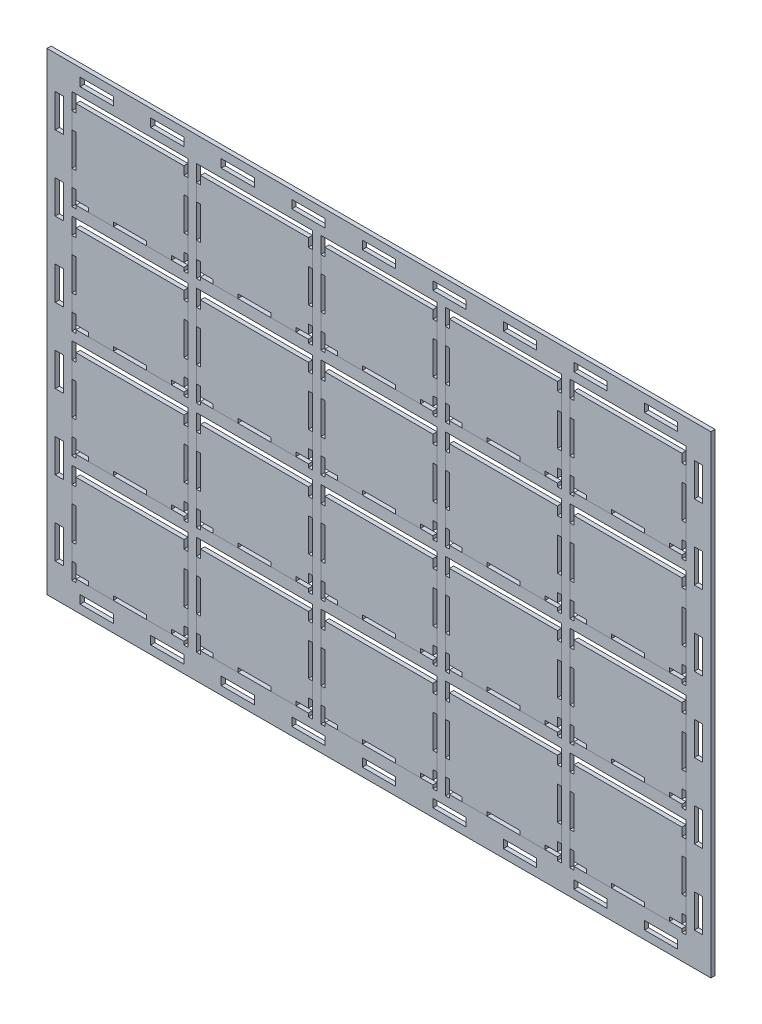
from build123d import *

# Parameters (mm, degrees)
SKETCH1_W              = 400
SKETCH1_H              = 285
SKETCH1_W_2            = 20
SKETCH1_H_2            = 5
SKETCH1_W_3            = 5
SKETCH1_H_3            = 20
BOSS_EXTRUDE1_DEPTH    = 2.5
BOSS_EXTRUDE2_DEPTH    = 2.5
BOSS_EXTRUDE2_2_DEPTH  = 2.5
BOSS_EXTRUDE2_3_DEPTH  = 2.5
BOSS_EXTRUDE2_4_DEPTH  = 2.5
BOSS_EXTRUDE2_5_DEPTH  = 2.5
BOSS_EXTRUDE2_6_DEPTH  = 2.5
BOSS_EXTRUDE2_7_DEPTH  = 2.5
BOSS_EXTRUDE2_8_DEPTH  = 2.5
BOSS_EXTRUDE2_9_DEPTH  = 2.5
BOSS_EXTRUDE2_10_DEPTH = 2.5
BOSS_EXTRUDE2_11_DEPTH = 2.5
BOSS_EXTRUDE2_12_DEPTH = 2.5
BOSS_EXTRUDE2_13_DEPTH = 2.5
BOSS_EXTRUDE2_14_DEPTH = 2.5
BOSS_EXTRUDE2_15_DEPTH = 2.5
BOSS_EXTRUDE2_16_DEPTH = 2.5
BOSS_EXTRUDE2_17_DEPTH = 2.5
BOSS_EXTRUDE2_18_DEPTH = 2.5
BOSS_EXTRUDE2_19_DEPTH = 2.5
BOSS_EXTRUDE2_20_DEPTH = 2.5


with BuildPart() as part:
    # Sketch1 → Boss-Extrude1 (new body)
    with BuildSketch(Plane.XY):
        with Locations((-141.295954422, 26.855853659)):
            Rectangle(SKETCH1_W, SKETCH1_H)
        with Locations((-311.295954422, -108.144146341)):
            Rectangle(SKETCH1_W_2, SKETCH1_H_2, mode=Mode.SUBTRACT)
        with Locations((-333.795954422, -85.644146341)):
            Rectangle(SKETCH1_W_3, SKETCH1_H_3, mode=Mode.SUBTRACT)
        with Locations((-268.795954422, -108.144146341)):
            Rectangle(SKETCH1_W_2, SKETCH1_H_2, mode=Mode.SUBTRACT)
        Polygon((-323.795954422, -98.644146341), (-323.795954422, -100.644146341), (-326.295954422, -100.644146341), (-326.295954422, -90.644146341), (-326.295954422, -80.644146341), (-326.295954422, -60.644146341), (-326.295954422, -50.644146341), (-326.295954422, -40.644146341), (-256.295954422, -40.644146341), (-256.295954422, -50.644146341), (-256.295954422, -60.644146341), (-256.295954422, -80.644146341), (-256.295954422, -90.644146341), (-256.295954422, -100.644146341), (-258.795954422, -100.644146341), (-258.795954422, -98.644146341), (-266.295954422, -98.644146341), (-281.295954422, -98.644146341), (-301.295954422, -98.644146341), (-316.295954422, -98.644146341), align=None, mode=Mode.SUBTRACT)
        with Locations((-226.295954422, -108.144146341)):
            Rectangle(SKETCH1_W_2, SKETCH1_H_2, mode=Mode.SUBTRACT)
        with Locations((-183.795954422, -108.144146341)):
            Rectangle(SKETCH1_W_2, SKETCH1_H_2, mode=Mode.SUBTRACT)
        Polygon((-248.795954422, -98.644146341), (-248.795954422, -100.644146341), (-251.295954422, -100.644146341), (-251.295954422, -90.644146341), (-251.295954422, -80.644146341), (-251.295954422, -60.644146341), (-251.295954422, -50.644146341), (-251.295954422, -40.644146341), (-181.295954422, -40.644146341), (-181.295954422, -50.644146341), (-181.295954422, -60.644146341), (-181.295954422, -80.644146341), (-181.295954422, -90.644146341), (-181.295954422, -100.644146341), (-183.795954422, -100.644146341), (-183.795954422, -98.644146341), (-191.295954422, -98.644146341), (-206.295954422, -98.644146341), (-226.295954422, -98.644146341), (-241.295954422, -98.644146341), align=None, mode=Mode.SUBTRACT)
        with Locations((-333.795954422, -40.644146341)):
            Rectangle(SKETCH1_W_3, SKETCH1_H_3, mode=Mode.SUBTRACT)
        with Locations((-333.795954422, 4.355853659)):
            Rectangle(SKETCH1_W_3, SKETCH1_H_3, mode=Mode.SUBTRACT)
        Polygon((-323.795954422, -33.644146341), (-323.795954422, -35.644146341), (-326.295954422, -35.644146341), (-326.295954422, -25.644146341), (-326.295954422, -15.644146341), (-326.295954422, 4.355853659), (-326.295954422, 14.355853659), (-326.295954422, 24.355853659), (-256.295954422, 24.355853659), (-256.295954422, 14.355853659), (-256.295954422, 4.355853659), (-256.295954422, -15.644146341), (-256.295954422, -25.644146341), (-256.295954422, -35.644146341), (-258.795954422, -35.644146341), (-258.795954422, -33.644146341), (-266.295954422, -33.644146341), (-281.295954422, -33.644146341), (-301.295954422, -33.644146341), (-316.295954422, -33.644146341), align=None, mode=Mode.SUBTRACT)
        Polygon((-248.795954422, -33.644146341), (-248.795954422, -35.644146341), (-251.295954422, -35.644146341), (-251.295954422, -25.644146341), (-251.295954422, -15.644146341), (-251.295954422, 4.355853659), (-251.295954422, 14.355853659), (-251.295954422, 24.355853659), (-181.295954422, 24.355853659), (-181.295954422, 14.355853659), (-181.295954422, 4.355853659), (-181.295954422, -15.644146341), (-181.295954422, -25.644146341), (-181.295954422, -35.644146341), (-183.795954422, -35.644146341), (-183.795954422, -33.644146341), (-191.295954422, -33.644146341), (-206.295954422, -33.644146341), (-226.295954422, -33.644146341), (-241.295954422, -33.644146341), align=None, mode=Mode.SUBTRACT)
        with Locations((-141.295954422, -108.144146341)):
            Rectangle(SKETCH1_W_2, SKETCH1_H_2, mode=Mode.SUBTRACT)
        with Locations((-98.795954422, -108.144146341)):
            Rectangle(SKETCH1_W_2, SKETCH1_H_2, mode=Mode.SUBTRACT)
        with Locations((-56.295954422, -108.144146341)):
            Rectangle(SKETCH1_W_2, SKETCH1_H_2, mode=Mode.SUBTRACT)
        Polygon((-173.795954422, -98.644146341), (-173.795954422, -100.644146341), (-176.295954422, -100.644146341), (-176.295954422, -90.644146341), (-176.295954422, -80.644146341), (-176.295954422, -60.644146341), (-176.295954422, -50.644146341), (-176.295954422, -40.644146341), (-106.295954422, -40.644146341), (-106.295954422, -50.644146341), (-106.295954422, -60.644146341), (-106.295954422, -80.644146341), (-106.295954422, -90.644146341), (-106.295954422, -100.644146341), (-108.795954422, -100.644146341), (-108.795954422, -98.644146341), (-116.295954422, -98.644146341), (-131.295954422, -98.644146341), (-151.295954422, -98.644146341), (-166.295954422, -98.644146341), align=None, mode=Mode.SUBTRACT)
        Polygon((-98.795954422, -98.644146341), (-98.795954422, -100.644146341), (-101.295954422, -100.644146341), (-101.295954422, -90.644146341), (-101.295954422, -80.644146341), (-101.295954422, -60.644146341), (-101.295954422, -50.644146341), (-101.295954422, -40.644146341), (-31.295954422, -40.644146341), (-31.295954422, -50.644146341), (-31.295954422, -60.644146341), (-31.295954422, -80.644146341), (-31.295954422, -90.644146341), (-31.295954422, -100.644146341), (-33.795954422, -100.644146341), (-33.795954422, -98.644146341), (-41.295954422, -98.644146341), (-56.295954422, -98.644146341), (-76.295954422, -98.644146341), (-91.295954422, -98.644146341), align=None, mode=Mode.SUBTRACT)
        with Locations((-13.795954422, -108.144146341)):
            Rectangle(SKETCH1_W_2, SKETCH1_H_2, mode=Mode.SUBTRACT)
        with Locations((28.704045578, -108.144146341)):
            Rectangle(SKETCH1_W_2, SKETCH1_H_2, mode=Mode.SUBTRACT)
        with Locations((51.204045578, -85.644146341)):
            Rectangle(SKETCH1_W_3, SKETCH1_H_3, mode=Mode.SUBTRACT)
        Polygon((-23.795954422, -98.644146341), (-23.795954422, -100.644146341), (-26.295954422, -100.644146341), (-26.295954422, -90.644146341), (-26.295954422, -80.644146341), (-26.295954422, -60.644146341), (-26.295954422, -50.644146341), (-26.295954422, -40.644146341), (43.704045578, -40.644146341), (43.704045578, -50.644146341), (43.704045578, -60.644146341), (43.704045578, -80.644146341), (43.704045578, -90.644146341), (43.704045578, -100.644146341), (41.204045578, -100.644146341), (41.204045578, -98.644146341), (33.704045578, -98.644146341), (18.704045578, -98.644146341), (-1.295954422, -98.644146341), (-16.295954422, -98.644146341), align=None, mode=Mode.SUBTRACT)
        Polygon((-173.795954422, -33.644146341), (-173.795954422, -35.644146341), (-176.295954422, -35.644146341), (-176.295954422, -25.644146341), (-176.295954422, -15.644146341), (-176.295954422, 4.355853659), (-176.295954422, 14.355853659), (-176.295954422, 24.355853659), (-106.295954422, 24.355853659), (-106.295954422, 14.355853659), (-106.295954422, 4.355853659), (-106.295954422, -15.644146341), (-106.295954422, -25.644146341), (-106.295954422, -35.644146341), (-108.795954422, -35.644146341), (-108.795954422, -33.644146341), (-116.295954422, -33.644146341), (-131.295954422, -33.644146341), (-151.295954422, -33.644146341), (-166.295954422, -33.644146341), align=None, mode=Mode.SUBTRACT)
        Polygon((-98.795954422, -33.644146341), (-98.795954422, -35.644146341), (-101.295954422, -35.644146341), (-101.295954422, -25.644146341), (-101.295954422, -15.644146341), (-101.295954422, 4.355853659), (-101.295954422, 14.355853659), (-101.295954422, 24.355853659), (-31.295954422, 24.355853659), (-31.295954422, 14.355853659), (-31.295954422, 4.355853659), (-31.295954422, -15.644146341), (-31.295954422, -25.644146341), (-31.295954422, -35.644146341), (-33.795954422, -35.644146341), (-33.795954422, -33.644146341), (-41.295954422, -33.644146341), (-56.295954422, -33.644146341), (-76.295954422, -33.644146341), (-91.295954422, -33.644146341), align=None, mode=Mode.SUBTRACT)
        with Locations((51.204045578, -40.644146341)):
            Rectangle(SKETCH1_W_3, SKETCH1_H_3, mode=Mode.SUBTRACT)
        Polygon((-23.795954422, -33.644146341), (-23.795954422, -35.644146341), (-26.295954422, -35.644146341), (-26.295954422, -25.644146341), (-26.295954422, -15.644146341), (-26.295954422, 4.355853659), (-26.295954422, 14.355853659), (-26.295954422, 24.355853659), (43.704045578, 24.355853659), (43.704045578, 14.355853659), (43.704045578, 4.355853659), (43.704045578, -15.644146341), (43.704045578, -25.644146341), (43.704045578, -35.644146341), (41.204045578, -35.644146341), (41.204045578, -33.644146341), (33.704045578, -33.644146341), (18.704045578, -33.644146341), (-1.295954422, -33.644146341), (-16.295954422, -33.644146341), align=None, mode=Mode.SUBTRACT)
        with Locations((51.204045578, 4.355853659)):
            Rectangle(SKETCH1_W_3, SKETCH1_H_3, mode=Mode.SUBTRACT)
        with Locations((-333.795954422, 49.355853659)):
            Rectangle(SKETCH1_W_3, SKETCH1_H_3, mode=Mode.SUBTRACT)
        Polygon((-323.795954422, 31.355853659), (-323.795954422, 29.355853659), (-326.295954422, 29.355853659), (-326.295954422, 39.355853659), (-326.295954422, 49.355853659), (-326.295954422, 69.355853659), (-326.295954422, 79.355853659), (-326.295954422, 89.355853659), (-256.295954422, 89.355853659), (-256.295954422, 79.355853659), (-256.295954422, 69.355853659), (-256.295954422, 49.355853659), (-256.295954422, 39.355853659), (-256.295954422, 29.355853659), (-258.795954422, 29.355853659), (-258.795954422, 31.355853659), (-266.295954422, 31.355853659), (-281.295954422, 31.355853659), (-301.295954422, 31.355853659), (-316.295954422, 31.355853659), align=None, mode=Mode.SUBTRACT)
        with Locations((-333.795954422, 94.355853659)):
            Rectangle(SKETCH1_W_3, SKETCH1_H_3, mode=Mode.SUBTRACT)
        Polygon((-248.795954422, 31.355853659), (-248.795954422, 29.355853659), (-251.295954422, 29.355853659), (-251.295954422, 39.355853659), (-251.295954422, 49.355853659), (-251.295954422, 69.355853659), (-251.295954422, 79.355853659), (-251.295954422, 89.355853659), (-181.295954422, 89.355853659), (-181.295954422, 79.355853659), (-181.295954422, 69.355853659), (-181.295954422, 49.355853659), (-181.295954422, 39.355853659), (-181.295954422, 29.355853659), (-183.795954422, 29.355853659), (-183.795954422, 31.355853659), (-191.295954422, 31.355853659), (-206.295954422, 31.355853659), (-226.295954422, 31.355853659), (-241.295954422, 31.355853659), align=None, mode=Mode.SUBTRACT)
        Polygon((-323.795954422, 96.355853659), (-323.795954422, 94.355853659), (-326.295954422, 94.355853659), (-326.295954422, 104.355853659), (-326.295954422, 114.355853659), (-326.295954422, 134.355853659), (-326.295954422, 144.355853659), (-326.295954422, 154.355853659), (-256.295954422, 154.355853659), (-256.295954422, 144.355853659), (-256.295954422, 134.355853659), (-256.295954422, 114.355853659), (-256.295954422, 104.355853659), (-256.295954422, 94.355853659), (-258.795954422, 94.355853659), (-258.795954422, 96.355853659), (-266.295954422, 96.355853659), (-281.295954422, 96.355853659), (-301.295954422, 96.355853659), (-316.295954422, 96.355853659), align=None, mode=Mode.SUBTRACT)
        with Locations((-333.795954422, 139.355853659)):
            Rectangle(SKETCH1_W_3, SKETCH1_H_3, mode=Mode.SUBTRACT)
        with Locations((-311.295954422, 161.855853659)):
            Rectangle(SKETCH1_W_2, SKETCH1_H_2, mode=Mode.SUBTRACT)
        with Locations((-268.795954422, 161.855853659)):
            Rectangle(SKETCH1_W_2, SKETCH1_H_2, mode=Mode.SUBTRACT)
        Polygon((-248.795954422, 96.355853659), (-248.795954422, 94.355853659), (-251.295954422, 94.355853659), (-251.295954422, 104.355853659), (-251.295954422, 114.355853659), (-251.295954422, 134.355853659), (-251.295954422, 144.355853659), (-251.295954422, 154.355853659), (-181.295954422, 154.355853659), (-181.295954422, 144.355853659), (-181.295954422, 134.355853659), (-181.295954422, 114.355853659), (-181.295954422, 104.355853659), (-181.295954422, 94.355853659), (-183.795954422, 94.355853659), (-183.795954422, 96.355853659), (-191.295954422, 96.355853659), (-206.295954422, 96.355853659), (-226.295954422, 96.355853659), (-241.295954422, 96.355853659), align=None, mode=Mode.SUBTRACT)
        with Locations((-226.295954422, 161.855853659)):
            Rectangle(SKETCH1_W_2, SKETCH1_H_2, mode=Mode.SUBTRACT)
        with Locations((-183.795954422, 161.855853659)):
            Rectangle(SKETCH1_W_2, SKETCH1_H_2, mode=Mode.SUBTRACT)
        Polygon((-173.795954422, 31.355853659), (-173.795954422, 29.355853659), (-176.295954422, 29.355853659), (-176.295954422, 39.355853659), (-176.295954422, 49.355853659), (-176.295954422, 69.355853659), (-176.295954422, 79.355853659), (-176.295954422, 89.355853659), (-106.295954422, 89.355853659), (-106.295954422, 79.355853659), (-106.295954422, 69.355853659), (-106.295954422, 49.355853659), (-106.295954422, 39.355853659), (-106.295954422, 29.355853659), (-108.795954422, 29.355853659), (-108.795954422, 31.355853659), (-116.295954422, 31.355853659), (-131.295954422, 31.355853659), (-151.295954422, 31.355853659), (-166.295954422, 31.355853659), align=None, mode=Mode.SUBTRACT)
        Polygon((-98.795954422, 31.355853659), (-98.795954422, 29.355853659), (-101.295954422, 29.355853659), (-101.295954422, 39.355853659), (-101.295954422, 49.355853659), (-101.295954422, 69.355853659), (-101.295954422, 79.355853659), (-101.295954422, 89.355853659), (-31.295954422, 89.355853659), (-31.295954422, 79.355853659), (-31.295954422, 69.355853659), (-31.295954422, 49.355853659), (-31.295954422, 39.355853659), (-31.295954422, 29.355853659), (-33.795954422, 29.355853659), (-33.795954422, 31.355853659), (-41.295954422, 31.355853659), (-56.295954422, 31.355853659), (-76.295954422, 31.355853659), (-91.295954422, 31.355853659), align=None, mode=Mode.SUBTRACT)
        Polygon((-23.795954422, 31.355853659), (-23.795954422, 29.355853659), (-26.295954422, 29.355853659), (-26.295954422, 39.355853659), (-26.295954422, 49.355853659), (-26.295954422, 69.355853659), (-26.295954422, 79.355853659), (-26.295954422, 89.355853659), (43.704045578, 89.355853659), (43.704045578, 79.355853659), (43.704045578, 69.355853659), (43.704045578, 49.355853659), (43.704045578, 39.355853659), (43.704045578, 29.355853659), (41.204045578, 29.355853659), (41.204045578, 31.355853659), (33.704045578, 31.355853659), (18.704045578, 31.355853659), (-1.295954422, 31.355853659), (-16.295954422, 31.355853659), align=None, mode=Mode.SUBTRACT)
        with Locations((51.204045578, 49.355853659)):
            Rectangle(SKETCH1_W_3, SKETCH1_H_3, mode=Mode.SUBTRACT)
        with Locations((51.204045578, 94.355853659)):
            Rectangle(SKETCH1_W_3, SKETCH1_H_3, mode=Mode.SUBTRACT)
        Polygon((-173.795954422, 96.355853659), (-173.795954422, 94.355853659), (-176.295954422, 94.355853659), (-176.295954422, 104.355853659), (-176.295954422, 114.355853659), (-176.295954422, 134.355853659), (-176.295954422, 144.355853659), (-176.295954422, 154.355853659), (-106.295954422, 154.355853659), (-106.295954422, 144.355853659), (-106.295954422, 134.355853659), (-106.295954422, 114.355853659), (-106.295954422, 104.355853659), (-106.295954422, 94.355853659), (-108.795954422, 94.355853659), (-108.795954422, 96.355853659), (-116.295954422, 96.355853659), (-131.295954422, 96.355853659), (-151.295954422, 96.355853659), (-166.295954422, 96.355853659), align=None, mode=Mode.SUBTRACT)
        Polygon((-98.795954422, 96.355853659), (-98.795954422, 94.355853659), (-101.295954422, 94.355853659), (-101.295954422, 104.355853659), (-101.295954422, 114.355853659), (-101.295954422, 134.355853659), (-101.295954422, 144.355853659), (-101.295954422, 154.355853659), (-31.295954422, 154.355853659), (-31.295954422, 144.355853659), (-31.295954422, 134.355853659), (-31.295954422, 114.355853659), (-31.295954422, 104.355853659), (-31.295954422, 94.355853659), (-33.795954422, 94.355853659), (-33.795954422, 96.355853659), (-41.295954422, 96.355853659), (-56.295954422, 96.355853659), (-76.295954422, 96.355853659), (-91.295954422, 96.355853659), align=None, mode=Mode.SUBTRACT)
        with Locations((-141.295954422, 161.855853659)):
            Rectangle(SKETCH1_W_2, SKETCH1_H_2, mode=Mode.SUBTRACT)
        with Locations((-98.795954422, 161.855853659)):
            Rectangle(SKETCH1_W_2, SKETCH1_H_2, mode=Mode.SUBTRACT)
        with Locations((-56.295954422, 161.855853659)):
            Rectangle(SKETCH1_W_2, SKETCH1_H_2, mode=Mode.SUBTRACT)
        Polygon((-23.795954422, 94.355853659), (-26.295954422, 94.355853659), (-26.295954422, 104.355853659), (-26.295954422, 114.355853659), (-26.295954422, 134.355853659), (-26.295954422, 144.355853659), (-26.295954422, 154.355853659), (43.704045578, 154.355853659), (43.704045578, 144.355853659), (43.704045578, 134.355853659), (43.704045578, 114.355853659), (43.704045578, 104.355853659), (43.704045578, 94.355853659), (41.204045578, 94.355853659), (41.204045578, 96.355853659), (33.704045578, 96.355853659), (18.704045578, 96.355853659), (-1.295954422, 96.355853659), (-16.295954422, 96.355853659), (-23.795954422, 96.355853659), align=None, mode=Mode.SUBTRACT)
        with Locations((-13.795954422, 161.855853659)):
            Rectangle(SKETCH1_W_2, SKETCH1_H_2, mode=Mode.SUBTRACT)
        with Locations((51.204045578, 139.355853659)):
            Rectangle(SKETCH1_W_3, SKETCH1_H_3, mode=Mode.SUBTRACT)
        with Locations((28.704045578, 161.855853659)):
            Rectangle(SKETCH1_W_2, SKETCH1_H_2, mode=Mode.SUBTRACT)
    extrude(amount=BOSS_EXTRUDE1_DEPTH)


with BuildPart() as body_2:
    # Sketch1<3> → Boss-Extrude2 (new body)
    with BuildSketch(Plane.XY):
        Polygon((-26.295954422, 114.355853659), (-26.295954422, 104.355853659), (-23.795954422, 104.355853659), (-23.795954422, 98.855853659), (-16.295954422, 98.855853659), (-16.295954422, 96.355853659), (-1.295954422, 96.355853659), (-1.295954422, 98.855853659), (18.704045578, 98.855853659), (18.704045578, 96.355853659), (33.704045578, 96.355853659), (33.704045578, 98.855853659), (41.204045578, 98.855853659), (41.204045578, 104.355853659), (43.704045578, 104.355853659), (43.704045578, 114.355853659), (41.204045578, 114.355853659), (41.204045578, 134.355853659), (43.704045578, 134.355853659), (43.704045578, 144.355853659), (41.204045578, 144.355853659), (41.204045578, 149.355853659), (-23.795954422, 149.355853659), (-23.795954422, 144.355853659), (-26.295954422, 144.355853659), (-26.295954422, 134.355853659), (-23.795954422, 134.355853659), (-23.795954422, 114.355853659), align=None)
    extrude(amount=BOSS_EXTRUDE2_DEPTH)


with BuildPart() as body_3:
    # Sketch1<3> → Boss-Extrude2 2 (new body)
    with BuildSketch(Plane.XY):
        Polygon((-26.295954422, 49.355853659), (-26.295954422, 39.355853659), (-23.795954422, 39.355853659), (-23.795954422, 33.855853659), (-16.295954422, 33.855853659), (-16.295954422, 31.355853659), (-1.295954422, 31.355853659), (-1.295954422, 33.855853659), (18.704045578, 33.855853659), (18.704045578, 31.355853659), (33.704045578, 31.355853659), (33.704045578, 33.855853659), (41.204045578, 33.855853659), (41.204045578, 39.355853659), (43.704045578, 39.355853659), (43.704045578, 49.355853659), (41.204045578, 49.355853659), (41.204045578, 69.355853659), (43.704045578, 69.355853659), (43.704045578, 79.355853659), (41.204045578, 79.355853659), (41.204045578, 84.355853659), (-23.795954422, 84.355853659), (-23.795954422, 79.355853659), (-26.295954422, 79.355853659), (-26.295954422, 69.355853659), (-23.795954422, 69.355853659), (-23.795954422, 49.355853659), align=None)
    extrude(amount=BOSS_EXTRUDE2_2_DEPTH)


with BuildPart() as body_4:
    # Sketch1<3> → Boss-Extrude2 3 (new body)
    with BuildSketch(Plane.XY):
        Polygon((-26.295954422, -15.644146341), (-26.295954422, -25.644146341), (-23.795954422, -25.644146341), (-23.795954422, -31.144146341), (-16.295954422, -31.144146341), (-16.295954422, -33.644146341), (-1.295954422, -33.644146341), (-1.295954422, -31.144146341), (18.704045578, -31.144146341), (18.704045578, -33.644146341), (33.704045578, -33.644146341), (33.704045578, -31.144146341), (41.204045578, -31.144146341), (41.204045578, -25.644146341), (43.704045578, -25.644146341), (43.704045578, -15.644146341), (41.204045578, -15.644146341), (41.204045578, 4.355853659), (43.704045578, 4.355853659), (43.704045578, 14.355853659), (41.204045578, 14.355853659), (41.204045578, 19.355853659), (-23.795954422, 19.355853659), (-23.795954422, 14.355853659), (-26.295954422, 14.355853659), (-26.295954422, 4.355853659), (-23.795954422, 4.355853659), (-23.795954422, -15.644146341), align=None)
    extrude(amount=BOSS_EXTRUDE2_3_DEPTH)


with BuildPart() as body_5:
    # Sketch1<3> → Boss-Extrude2 4 (new body)
    with BuildSketch(Plane.XY):
        Polygon((-26.295954422, -80.644146341), (-26.295954422, -90.644146341), (-23.795954422, -90.644146341), (-23.795954422, -96.144146341), (-16.295954422, -96.144146341), (-16.295954422, -98.644146341), (-1.295954422, -98.644146341), (-1.295954422, -96.144146341), (18.704045578, -96.144146341), (18.704045578, -98.644146341), (33.704045578, -98.644146341), (33.704045578, -96.144146341), (41.204045578, -96.144146341), (41.204045578, -90.644146341), (43.704045578, -90.644146341), (43.704045578, -80.644146341), (41.204045578, -80.644146341), (41.204045578, -60.644146341), (43.704045578, -60.644146341), (43.704045578, -50.644146341), (41.204045578, -50.644146341), (41.204045578, -45.644146341), (-23.795954422, -45.644146341), (-23.795954422, -50.644146341), (-26.295954422, -50.644146341), (-26.295954422, -60.644146341), (-23.795954422, -60.644146341), (-23.795954422, -80.644146341), align=None)
    extrude(amount=BOSS_EXTRUDE2_4_DEPTH)


with BuildPart() as body_6:
    # Sketch1<3> → Boss-Extrude2 5 (new body)
    with BuildSketch(Plane.XY):
        Polygon((-101.295954422, 114.355853659), (-101.295954422, 104.355853659), (-98.795954422, 104.355853659), (-98.795954422, 98.855853659), (-91.295954422, 98.855853659), (-91.295954422, 96.355853659), (-76.295954422, 96.355853659), (-76.295954422, 98.855853659), (-56.295954422, 98.855853659), (-56.295954422, 96.355853659), (-41.295954422, 96.355853659), (-41.295954422, 98.855853659), (-33.795954422, 98.855853659), (-33.795954422, 104.355853659), (-31.295954422, 104.355853659), (-31.295954422, 114.355853659), (-33.795954422, 114.355853659), (-33.795954422, 134.355853659), (-31.295954422, 134.355853659), (-31.295954422, 144.355853659), (-33.795954422, 144.355853659), (-33.795954422, 149.355853659), (-98.795954422, 149.355853659), (-98.795954422, 144.355853659), (-101.295954422, 144.355853659), (-101.295954422, 134.355853659), (-98.795954422, 134.355853659), (-98.795954422, 114.355853659), align=None)
    extrude(amount=BOSS_EXTRUDE2_5_DEPTH)


with BuildPart() as body_7:
    # Sketch1<3> → Boss-Extrude2 6 (new body)
    with BuildSketch(Plane.XY):
        Polygon((-101.295954422, 49.355853659), (-101.295954422, 39.355853659), (-98.795954422, 39.355853659), (-98.795954422, 33.855853659), (-91.295954422, 33.855853659), (-91.295954422, 31.355853659), (-76.295954422, 31.355853659), (-76.295954422, 33.855853659), (-56.295954422, 33.855853659), (-56.295954422, 31.355853659), (-41.295954422, 31.355853659), (-41.295954422, 33.855853659), (-33.795954422, 33.855853659), (-33.795954422, 39.355853659), (-31.295954422, 39.355853659), (-31.295954422, 49.355853659), (-33.795954422, 49.355853659), (-33.795954422, 69.355853659), (-31.295954422, 69.355853659), (-31.295954422, 79.355853659), (-33.795954422, 79.355853659), (-33.795954422, 84.355853659), (-98.795954422, 84.355853659), (-98.795954422, 79.355853659), (-101.295954422, 79.355853659), (-101.295954422, 69.355853659), (-98.795954422, 69.355853659), (-98.795954422, 49.355853659), align=None)
    extrude(amount=BOSS_EXTRUDE2_6_DEPTH)


with BuildPart() as body_8:
    # Sketch1<3> → Boss-Extrude2 7 (new body)
    with BuildSketch(Plane.XY):
        Polygon((-101.295954422, -15.644146341), (-101.295954422, -25.644146341), (-98.795954422, -25.644146341), (-98.795954422, -31.144146341), (-91.295954422, -31.144146341), (-91.295954422, -33.644146341), (-76.295954422, -33.644146341), (-76.295954422, -31.144146341), (-56.295954422, -31.144146341), (-56.295954422, -33.644146341), (-41.295954422, -33.644146341), (-41.295954422, -31.144146341), (-33.795954422, -31.144146341), (-33.795954422, -25.644146341), (-31.295954422, -25.644146341), (-31.295954422, -15.644146341), (-33.795954422, -15.644146341), (-33.795954422, 4.355853659), (-31.295954422, 4.355853659), (-31.295954422, 14.355853659), (-33.795954422, 14.355853659), (-33.795954422, 19.355853659), (-98.795954422, 19.355853659), (-98.795954422, 14.355853659), (-101.295954422, 14.355853659), (-101.295954422, 4.355853659), (-98.795954422, 4.355853659), (-98.795954422, -15.644146341), align=None)
    extrude(amount=BOSS_EXTRUDE2_7_DEPTH)


with BuildPart() as body_9:
    # Sketch1<3> → Boss-Extrude2 8 (new body)
    with BuildSketch(Plane.XY):
        Polygon((-101.295954422, -80.644146341), (-101.295954422, -90.644146341), (-98.795954422, -90.644146341), (-98.795954422, -96.144146341), (-91.295954422, -96.144146341), (-91.295954422, -98.644146341), (-76.295954422, -98.644146341), (-76.295954422, -96.144146341), (-56.295954422, -96.144146341), (-56.295954422, -98.644146341), (-41.295954422, -98.644146341), (-41.295954422, -96.144146341), (-33.795954422, -96.144146341), (-33.795954422, -90.644146341), (-31.295954422, -90.644146341), (-31.295954422, -80.644146341), (-33.795954422, -80.644146341), (-33.795954422, -60.644146341), (-31.295954422, -60.644146341), (-31.295954422, -50.644146341), (-33.795954422, -50.644146341), (-33.795954422, -45.644146341), (-98.795954422, -45.644146341), (-98.795954422, -50.644146341), (-101.295954422, -50.644146341), (-101.295954422, -60.644146341), (-98.795954422, -60.644146341), (-98.795954422, -80.644146341), align=None)
    extrude(amount=BOSS_EXTRUDE2_8_DEPTH)


with BuildPart() as body_10:
    # Sketch1<3> → Boss-Extrude2 9 (new body)
    with BuildSketch(Plane.XY):
        Polygon((-176.295954422, 114.355853659), (-176.295954422, 104.355853659), (-173.795954422, 104.355853659), (-173.795954422, 98.855853659), (-166.295954422, 98.855853659), (-166.295954422, 96.355853659), (-151.295954422, 96.355853659), (-151.295954422, 98.855853659), (-131.295954422, 98.855853659), (-131.295954422, 96.355853659), (-116.295954422, 96.355853659), (-116.295954422, 98.855853659), (-108.795954422, 98.855853659), (-108.795954422, 104.355853659), (-106.295954422, 104.355853659), (-106.295954422, 114.355853659), (-108.795954422, 114.355853659), (-108.795954422, 134.355853659), (-106.295954422, 134.355853659), (-106.295954422, 144.355853659), (-108.795954422, 144.355853659), (-108.795954422, 149.355853659), (-173.795954422, 149.355853659), (-173.795954422, 144.355853659), (-176.295954422, 144.355853659), (-176.295954422, 134.355853659), (-173.795954422, 134.355853659), (-173.795954422, 114.355853659), align=None)
    extrude(amount=BOSS_EXTRUDE2_9_DEPTH)


with BuildPart() as body_11:
    # Sketch1<3> → Boss-Extrude2 10 (new body)
    with BuildSketch(Plane.XY):
        Polygon((-176.295954422, 49.355853659), (-176.295954422, 39.355853659), (-173.795954422, 39.355853659), (-173.795954422, 33.855853659), (-166.295954422, 33.855853659), (-166.295954422, 31.355853659), (-151.295954422, 31.355853659), (-151.295954422, 33.855853659), (-131.295954422, 33.855853659), (-131.295954422, 31.355853659), (-116.295954422, 31.355853659), (-116.295954422, 33.855853659), (-108.795954422, 33.855853659), (-108.795954422, 39.355853659), (-106.295954422, 39.355853659), (-106.295954422, 49.355853659), (-108.795954422, 49.355853659), (-108.795954422, 69.355853659), (-106.295954422, 69.355853659), (-106.295954422, 79.355853659), (-108.795954422, 79.355853659), (-108.795954422, 84.355853659), (-173.795954422, 84.355853659), (-173.795954422, 79.355853659), (-176.295954422, 79.355853659), (-176.295954422, 69.355853659), (-173.795954422, 69.355853659), (-173.795954422, 49.355853659), align=None)
    extrude(amount=BOSS_EXTRUDE2_10_DEPTH)


with BuildPart() as body_12:
    # Sketch1<3> → Boss-Extrude2 11 (new body)
    with BuildSketch(Plane.XY):
        Polygon((-176.295954422, -15.644146341), (-176.295954422, -25.644146341), (-173.795954422, -25.644146341), (-173.795954422, -31.144146341), (-166.295954422, -31.144146341), (-166.295954422, -33.644146341), (-151.295954422, -33.644146341), (-151.295954422, -31.144146341), (-131.295954422, -31.144146341), (-131.295954422, -33.644146341), (-116.295954422, -33.644146341), (-116.295954422, -31.144146341), (-108.795954422, -31.144146341), (-108.795954422, -25.644146341), (-106.295954422, -25.644146341), (-106.295954422, -15.644146341), (-108.795954422, -15.644146341), (-108.795954422, 4.355853659), (-106.295954422, 4.355853659), (-106.295954422, 14.355853659), (-108.795954422, 14.355853659), (-108.795954422, 19.355853659), (-173.795954422, 19.355853659), (-173.795954422, 14.355853659), (-176.295954422, 14.355853659), (-176.295954422, 4.355853659), (-173.795954422, 4.355853659), (-173.795954422, -15.644146341), align=None)
    extrude(amount=BOSS_EXTRUDE2_11_DEPTH)


with BuildPart() as body_13:
    # Sketch1<3> → Boss-Extrude2 12 (new body)
    with BuildSketch(Plane.XY):
        Polygon((-176.295954422, -80.644146341), (-176.295954422, -90.644146341), (-173.795954422, -90.644146341), (-173.795954422, -96.144146341), (-166.295954422, -96.144146341), (-166.295954422, -98.644146341), (-151.295954422, -98.644146341), (-151.295954422, -96.144146341), (-131.295954422, -96.144146341), (-131.295954422, -98.644146341), (-116.295954422, -98.644146341), (-116.295954422, -96.144146341), (-108.795954422, -96.144146341), (-108.795954422, -90.644146341), (-106.295954422, -90.644146341), (-106.295954422, -80.644146341), (-108.795954422, -80.644146341), (-108.795954422, -60.644146341), (-106.295954422, -60.644146341), (-106.295954422, -50.644146341), (-108.795954422, -50.644146341), (-108.795954422, -45.644146341), (-173.795954422, -45.644146341), (-173.795954422, -50.644146341), (-176.295954422, -50.644146341), (-176.295954422, -60.644146341), (-173.795954422, -60.644146341), (-173.795954422, -80.644146341), align=None)
    extrude(amount=BOSS_EXTRUDE2_12_DEPTH)


with BuildPart() as body_14:
    # Sketch1<3> → Boss-Extrude2 13 (new body)
    with BuildSketch(Plane.XY):
        Polygon((-251.295954422, 114.355853659), (-251.295954422, 104.355853659), (-248.795954422, 104.355853659), (-248.795954422, 98.855853659), (-241.295954422, 98.855853659), (-241.295954422, 96.355853659), (-226.295954422, 96.355853659), (-226.295954422, 98.855853659), (-206.295954422, 98.855853659), (-206.295954422, 96.355853659), (-191.295954422, 96.355853659), (-191.295954422, 98.855853659), (-183.795954422, 98.855853659), (-183.795954422, 104.355853659), (-181.295954422, 104.355853659), (-181.295954422, 114.355853659), (-183.795954422, 114.355853659), (-183.795954422, 134.355853659), (-181.295954422, 134.355853659), (-181.295954422, 144.355853659), (-183.795954422, 144.355853659), (-183.795954422, 149.355853659), (-248.795954422, 149.355853659), (-248.795954422, 144.355853659), (-251.295954422, 144.355853659), (-251.295954422, 134.355853659), (-248.795954422, 134.355853659), (-248.795954422, 114.355853659), align=None)
    extrude(amount=BOSS_EXTRUDE2_13_DEPTH)


with BuildPart() as body_15:
    # Sketch1<3> → Boss-Extrude2 14 (new body)
    with BuildSketch(Plane.XY):
        Polygon((-251.295954422, 49.355853659), (-251.295954422, 39.355853659), (-248.795954422, 39.355853659), (-248.795954422, 33.855853659), (-241.295954422, 33.855853659), (-241.295954422, 31.355853659), (-226.295954422, 31.355853659), (-226.295954422, 33.855853659), (-206.295954422, 33.855853659), (-206.295954422, 31.355853659), (-191.295954422, 31.355853659), (-191.295954422, 33.855853659), (-183.795954422, 33.855853659), (-183.795954422, 39.355853659), (-181.295954422, 39.355853659), (-181.295954422, 49.355853659), (-183.795954422, 49.355853659), (-183.795954422, 69.355853659), (-181.295954422, 69.355853659), (-181.295954422, 79.355853659), (-183.795954422, 79.355853659), (-183.795954422, 84.355853659), (-248.795954422, 84.355853659), (-248.795954422, 79.355853659), (-251.295954422, 79.355853659), (-251.295954422, 69.355853659), (-248.795954422, 69.355853659), (-248.795954422, 49.355853659), align=None)
    extrude(amount=BOSS_EXTRUDE2_14_DEPTH)


with BuildPart() as body_16:
    # Sketch1<3> → Boss-Extrude2 15 (new body)
    with BuildSketch(Plane.XY):
        Polygon((-251.295954422, -15.644146341), (-251.295954422, -25.644146341), (-248.795954422, -25.644146341), (-248.795954422, -31.144146341), (-241.295954422, -31.144146341), (-241.295954422, -33.644146341), (-226.295954422, -33.644146341), (-226.295954422, -31.144146341), (-206.295954422, -31.144146341), (-206.295954422, -33.644146341), (-191.295954422, -33.644146341), (-191.295954422, -31.144146341), (-183.795954422, -31.144146341), (-183.795954422, -25.644146341), (-181.295954422, -25.644146341), (-181.295954422, -15.644146341), (-183.795954422, -15.644146341), (-183.795954422, 4.355853659), (-181.295954422, 4.355853659), (-181.295954422, 14.355853659), (-183.795954422, 14.355853659), (-183.795954422, 19.355853659), (-248.795954422, 19.355853659), (-248.795954422, 14.355853659), (-251.295954422, 14.355853659), (-251.295954422, 4.355853659), (-248.795954422, 4.355853659), (-248.795954422, -15.644146341), align=None)
    extrude(amount=BOSS_EXTRUDE2_15_DEPTH)


with BuildPart() as body_17:
    # Sketch1<3> → Boss-Extrude2 16 (new body)
    with BuildSketch(Plane.XY):
        Polygon((-251.295954422, -80.644146341), (-251.295954422, -90.644146341), (-248.795954422, -90.644146341), (-248.795954422, -96.144146341), (-241.295954422, -96.144146341), (-241.295954422, -98.644146341), (-226.295954422, -98.644146341), (-226.295954422, -96.144146341), (-206.295954422, -96.144146341), (-206.295954422, -98.644146341), (-191.295954422, -98.644146341), (-191.295954422, -96.144146341), (-183.795954422, -96.144146341), (-183.795954422, -90.644146341), (-181.295954422, -90.644146341), (-181.295954422, -80.644146341), (-183.795954422, -80.644146341), (-183.795954422, -60.644146341), (-181.295954422, -60.644146341), (-181.295954422, -50.644146341), (-183.795954422, -50.644146341), (-183.795954422, -45.644146341), (-248.795954422, -45.644146341), (-248.795954422, -50.644146341), (-251.295954422, -50.644146341), (-251.295954422, -60.644146341), (-248.795954422, -60.644146341), (-248.795954422, -80.644146341), align=None)
    extrude(amount=BOSS_EXTRUDE2_16_DEPTH)


with BuildPart() as body_18:
    # Sketch1<3> → Boss-Extrude2 17 (new body)
    with BuildSketch(Plane.XY):
        Polygon((-326.295954422, 114.355853659), (-326.295954422, 104.355853659), (-323.795954422, 104.355853659), (-323.795954422, 98.855853659), (-316.295954422, 98.855853659), (-316.295954422, 96.355853659), (-301.295954422, 96.355853659), (-301.295954422, 98.855853659), (-281.295954422, 98.855853659), (-281.295954422, 96.355853659), (-266.295954422, 96.355853659), (-266.295954422, 98.855853659), (-258.795954422, 98.855853659), (-258.795954422, 104.355853659), (-256.295954422, 104.355853659), (-256.295954422, 114.355853659), (-258.795954422, 114.355853659), (-258.795954422, 134.355853659), (-256.295954422, 134.355853659), (-256.295954422, 144.355853659), (-258.795954422, 144.355853659), (-258.795954422, 149.355853659), (-323.795954422, 149.355853659), (-323.795954422, 144.355853659), (-326.295954422, 144.355853659), (-326.295954422, 134.355853659), (-323.795954422, 134.355853659), (-323.795954422, 114.355853659), align=None)
    extrude(amount=BOSS_EXTRUDE2_17_DEPTH)


with BuildPart() as body_19:
    # Sketch1<3> → Boss-Extrude2 18 (new body)
    with BuildSketch(Plane.XY):
        Polygon((-326.295954422, 49.355853659), (-326.295954422, 39.355853659), (-323.795954422, 39.355853659), (-323.795954422, 33.855853659), (-316.295954422, 33.855853659), (-316.295954422, 31.355853659), (-301.295954422, 31.355853659), (-301.295954422, 33.855853659), (-281.295954422, 33.855853659), (-281.295954422, 31.355853659), (-266.295954422, 31.355853659), (-266.295954422, 33.855853659), (-258.795954422, 33.855853659), (-258.795954422, 39.355853659), (-256.295954422, 39.355853659), (-256.295954422, 49.355853659), (-258.795954422, 49.355853659), (-258.795954422, 69.355853659), (-256.295954422, 69.355853659), (-256.295954422, 79.355853659), (-258.795954422, 79.355853659), (-258.795954422, 84.355853659), (-323.795954422, 84.355853659), (-323.795954422, 79.355853659), (-326.295954422, 79.355853659), (-326.295954422, 69.355853659), (-323.795954422, 69.355853659), (-323.795954422, 49.355853659), align=None)
    extrude(amount=BOSS_EXTRUDE2_18_DEPTH)


with BuildPart() as body_20:
    # Sketch1<3> → Boss-Extrude2 19 (new body)
    with BuildSketch(Plane.XY):
        Polygon((-326.295954422, -15.644146341), (-326.295954422, -25.644146341), (-323.795954422, -25.644146341), (-323.795954422, -31.144146341), (-316.295954422, -31.144146341), (-316.295954422, -33.644146341), (-301.295954422, -33.644146341), (-301.295954422, -31.144146341), (-281.295954422, -31.144146341), (-281.295954422, -33.644146341), (-266.295954422, -33.644146341), (-266.295954422, -31.144146341), (-258.795954422, -31.144146341), (-258.795954422, -25.644146341), (-256.295954422, -25.644146341), (-256.295954422, -15.644146341), (-258.795954422, -15.644146341), (-258.795954422, 4.355853659), (-256.295954422, 4.355853659), (-256.295954422, 14.355853659), (-258.795954422, 14.355853659), (-258.795954422, 19.355853659), (-323.795954422, 19.355853659), (-323.795954422, 14.355853659), (-326.295954422, 14.355853659), (-326.295954422, 4.355853659), (-323.795954422, 4.355853659), (-323.795954422, -15.644146341), align=None)
    extrude(amount=BOSS_EXTRUDE2_19_DEPTH)


with BuildPart() as body_21:
    # Sketch1<3> → Boss-Extrude2 20 (new body)
    with BuildSketch(Plane.XY):
        Polygon((-326.295954422, -80.644146341), (-326.295954422, -90.644146341), (-323.795954422, -90.644146341), (-323.795954422, -96.144146341), (-316.295954422, -96.144146341), (-316.295954422, -98.644146341), (-301.295954422, -98.644146341), (-301.295954422, -96.144146341), (-281.295954422, -96.144146341), (-281.295954422, -98.644146341), (-266.295954422, -98.644146341), (-266.295954422, -96.144146341), (-258.795954422, -96.144146341), (-258.795954422, -90.644146341), (-256.295954422, -90.644146341), (-256.295954422, -80.644146341), (-258.795954422, -80.644146341), (-258.795954422, -60.644146341), (-256.295954422, -60.644146341), (-256.295954422, -50.644146341), (-258.795954422, -50.644146341), (-258.795954422, -45.644146341), (-323.795954422, -45.644146341), (-323.795954422, -50.644146341), (-326.295954422, -50.644146341), (-326.295954422, -60.644146341), (-323.795954422, -60.644146341), (-323.795954422, -80.644146341), align=None)
    extrude(amount=BOSS_EXTRUDE2_20_DEPTH)


solid = Compound([part.part, body_2.part, body_3.part, body_4.part, body_5.part, body_6.part, body_7.part, body_8.part, body_9.part, body_10.part, body_11.part, body_12.part, body_13.part, body_14.part, body_15.part, body_16.part, body_17.part, body_18.part, body_19.part, body_20.part, body_21.part])
